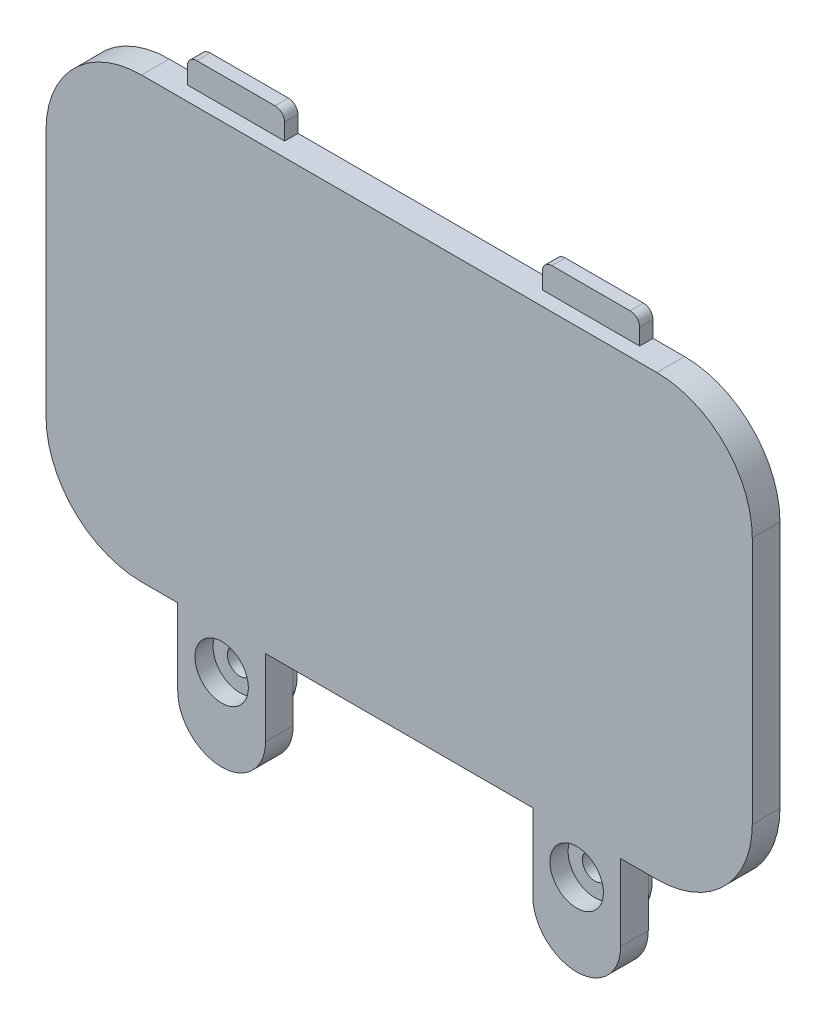
from build123d import *

# Parameters (mm, degrees)
EXTRUSION1_DEPTH                  = 2.9
ESQUISSE2_W                       = 10.2
ESQUISSE2_H                       = 1.4
EXTRUSION2_DEPTH                  = 2.7
CONG_1_R                          = 1
ESQUISSE3_W                       = 20.466591469
ESQUISSE3_H                       = 12.2
ESQUISSE3_W_2                     = 21.733408531
ESQUISSE3_W_3                     = 12.4
ESQUISSE3_H_2                     = 13.863540316
ENL_V_MAT_EXTRU_1_DEPTH           = 1
ESQUISSE4_R                       = 2.8
ENL_V_MAT_EXTRU_2_DEPTH           = 2
EXTRUSION3_DEPTH                  = 1
EXTRUSION3_DEPTH_BACK             = 1
ESQUISSE5_R                       = 4.6
CONG_2_R                          = 1
ESQUISSE6_R                       = 1.3
ENL_V_MAT_EXTRU_4_DEPTH           = 51.085976067
EXTRUSION4_DEPTH                  = 1
R_P_TITION_LIN_AIRE1_COUNT        = 2
R_P_TITION_LIN_AIRE1_PITCH        = 6
R_P_TITION_LIN_AIRE2_COUNT        = 2
R_P_TITION_LIN_AIRE2_PITCH        = 36.6
R_P_TITION_LIN_AIRE2_COPY_1_DEPTH = 1


with BuildPart() as part:
    # Esquisse1 → Extrusion1 (new body)
    with BuildSketch(Plane.XY):
        with BuildLine():
            Line((23.2, -23.001261172), (23.2, -15.001261172))
            Line((23.2, -15.001261172), (27, -15.001261172))
            ThreePointArc((27, -15.001261172), (34.071067812, -12.072328984), (37, -5.001261172))
            Line((37, -5.001261172), (37, 20.998738828))
            ThreePointArc((37, 20.998738828), (34.071067812, 28.069806639), (27, 30.998738828))
            Line((27, 30.998738828), (-27, 30.998738828))
            ThreePointArc((-27, 30.998738828), (-34.071067812, 28.069806639), (-37, 20.998738828))
            Line((-37, 20.998738828), (-37, -5.001261172))
            ThreePointArc((-37, -5.001261172), (-34.071067812, -12.072328984), (-27, -15.001261172))
            Line((-27, -15.001261172), (-23.2, -15.001261172))
            Line((-23.2, -15.001261172), (-23.2, -23.001261172))
            ThreePointArc((-23.2, -23.001261172), (-18.6, -27.601261172), (-14, -23.001261172))
            Line((-14, -23.001261172), (-14, -15.001261172))
            Line((-14, -15.001261172), (14, -15.001261172))
            Line((14, -15.001261172), (14, -23.001261172))
            ThreePointArc((14, -23.001261172), (18.6, -27.601261172), (23.2, -23.001261172))
        make_face()
    extrude(amount=-EXTRUSION1_DEPTH)

    # Esquisse2 → Extrusion2 (add)
    with BuildSketch(Plane(origin=(0, 30.998738828, 0), x_dir=(-1, 0, 0), z_dir=(0, 1, 0))):
        with Locations((-18.6, -2.2)):
            Rectangle(ESQUISSE2_W, ESQUISSE2_H)
        with Locations((18.6, -2.2)):
            Rectangle(ESQUISSE2_W, ESQUISSE2_H)
    extrude(amount=EXTRUSION2_DEPTH)

    # Congé1
    cong_1_edges = [part.edges().sort_by_distance(p)[0] for p in [
        (23.7, 33.698738828, -2.2),
        (13.5, 33.698738828, -2.2),
        (-23.7, 33.698738828, -2.2),
        (-13.5, 33.698738828, -2.2),
    ]]
    fillet(cong_1_edges, radius=CONG_1_R)

    # Esquisse3 → Enlèv. mat.-Extru.1 (cut)
    with BuildSketch(Plane(origin=(0, 0, -2.9), x_dir=(-1, 0, 0), z_dir=(0, 0, -1))):
        with BuildLine():
            Line((35.6, -5.001261172), (35.6, 0.735198512))
            Line((35.6, 0.735198512), (23.2, 0.735198512))
            Line((23.2, 0.735198512), (23.2, -13.601261172))
            Line((23.2, -13.601261172), (27, -13.601261172))
            ThreePointArc((27, -13.601261172), (33.081118318, -11.082379491), (35.6, -5.001261172))
        make_face()
        with BuildLine():
            Line((21.8, -23.001261172), (21.8, -13.601261172))
            Line((21.8, -13.601261172), (21.8, 0.735198512))
            Line((21.8, 0.735198512), (0.066591469, 0.735198512))
            Line((0.066591469, 0.735198512), (0.066591469, -11.464801488))
            Line((0.066591469, -11.464801488), (15.4, -11.464801488))
            Line((15.4, -11.464801488), (15.4, -23.001261172))
            ThreePointArc((15.4, -23.001261172), (18.6, -26.201261172), (21.8, -23.001261172))
        make_face()
        with BuildLine():
            Line((-15.4, -11.464801488), (-1.333408531, -11.464801488))
            Line((-1.333408531, -11.464801488), (-1.333408531, 0.735198512))
            Line((-1.333408531, 0.735198512), (-21.8, 0.735198512))
            Line((-21.8, 0.735198512), (-21.8, -13.601261172))
            Line((-21.8, -13.601261172), (-21.8, -23.001261172))
            ThreePointArc((-21.8, -23.001261172), (-18.6, -26.201261172), (-15.4, -23.001261172))
            Line((-15.4, -23.001261172), (-15.4, -11.464801488))
        make_face()
        with BuildLine():
            Line((-27, -13.601261172), (-23.2, -13.601261172))
            Line((-23.2, -13.601261172), (-23.2, 0.735198512))
            Line((-23.2, 0.735198512), (-35.6, 0.735198512))
            Line((-35.6, 0.735198512), (-35.6, -5.001261172))
            ThreePointArc((-35.6, -5.001261172), (-33.081118318, -11.082379491), (-27, -13.601261172))
        make_face()
        with BuildLine():
            Line((-35.6, 20.998738828), (-35.6, 17.398738828))
            Line((-35.6, 17.398738828), (-23.2, 17.398738828))
            Line((-23.2, 17.398738828), (-23.2, 29.598738828))
            Line((-23.2, 29.598738828), (-27, 29.598738828))
            ThreePointArc((-27, 29.598738828), (-33.081118318, 27.079857146), (-35.6, 20.998738828))
        make_face()
        with BuildLine():
            Line((27, 29.598738828), (23.2, 29.598738828))
            Line((23.2, 29.598738828), (23.2, 17.398738828))
            Line((23.2, 17.398738828), (35.6, 17.398738828))
            Line((35.6, 17.398738828), (35.6, 20.998738828))
            ThreePointArc((35.6, 20.998738828), (33.081118318, 27.079857146), (27, 29.598738828))
        make_face()
        with Locations((-11.566704266, 23.498738828)):
            Rectangle(ESQUISSE3_W, ESQUISSE3_H)
        with Locations((10.933295734, 23.498738828)):
            Rectangle(ESQUISSE3_W_2, ESQUISSE3_H)
        with Locations((-29.4, 9.06696867)):
            Rectangle(ESQUISSE3_W_3, ESQUISSE3_H_2)
        with Locations((-11.566704266, 9.06696867)):
            Rectangle(ESQUISSE3_W, ESQUISSE3_H_2)
        with Locations((10.933295734, 9.06696867)):
            Rectangle(ESQUISSE3_W_2, ESQUISSE3_H_2)
        with Locations((29.4, 9.06696867)):
            Rectangle(ESQUISSE3_W_3, ESQUISSE3_H_2)
    extrude(amount=-ENL_V_MAT_EXTRU_1_DEPTH, mode=Mode.SUBTRACT)

    # Esquisse4 → Enlèv. mat.-Extru.2 (cut)
    with BuildSketch(Plane.XY):
        with Locations((-18.6, -19.001261172)):
            Circle(ESQUISSE4_R)
        with Locations((18.6, -19.001261172)):
            Circle(ESQUISSE4_R)
    extrude(amount=-ENL_V_MAT_EXTRU_2_DEPTH, mode=Mode.SUBTRACT)

    # Esquisse5 → Extrusion3 (add, two sides: drawn at the far end of the back side and taken through both)
    with BuildSketch(Plane(origin=(0, 0, -2.9), x_dir=(-1, 0, 0), z_dir=(0, 0, -1)).offset(-EXTRUSION3_DEPTH_BACK)):
        with Locations((-18.6, -19.001261172)):
            Circle(ESQUISSE5_R)
        with Locations((18.6, -19.001261172)):
            Circle(ESQUISSE5_R)
    extrude(amount=EXTRUSION3_DEPTH + EXTRUSION3_DEPTH_BACK)

    # Congé2
    cong_2_edges = [part.edges().sort_by_distance(p)[0] for p in [
        (23.2, -19.001261172, -3.9),
        (-14, -19.001261172, -3.9),
    ]]
    fillet(cong_2_edges, radius=CONG_2_R - 0.0001)  # a hair under: the kernel refuses the full size

    # Esquisse6 → Enlèv. mat.-Extru.4 (cut, through all)
    with BuildSketch(Plane.XY.offset(-1.9)):
        with Locations((18.6, -19.001261172)):
            Circle(ESQUISSE6_R)
        with Locations((-18.6, -19.001261172)):
            Circle(ESQUISSE6_R)
    extrude(amount=-ENL_V_MAT_EXTRU_4_DEPTH, mode=Mode.SUBTRACT)

    # Esquisse7 → Extrusion4 (add)
    with BuildSketch(Plane.ZY.offset(-21.8)):
        Polygon((-2.9, 32.698738828), (-3.9, 32.334768593), (-3.9, 29.534768593), (-1.9, 27.398738828), (-1.9, 29.598738828), (-2.9, 29.598738828), align=None)
    extrusion4 = extrude(amount=EXTRUSION4_DEPTH)

    # Répétition linéaire1: Extrusion4 ×2
    with Locations(*[(-i * R_P_TITION_LIN_AIRE1_PITCH, 0, 0) for i in range(1, R_P_TITION_LIN_AIRE1_COUNT)]):
        add(extrusion4)

    # Répétition linéaire2: Extrusion4 ×2
    with Locations(*[(-i * R_P_TITION_LIN_AIRE2_PITCH, 0, 0) for i in range(1, R_P_TITION_LIN_AIRE2_COUNT)]):
        add(extrusion4)

    # Répétition linéaire2 copy 1 sketch → Répétition linéaire2 copy 1 (add)
    with BuildSketch(Plane.ZY.offset(20.8)):
        Polygon((-2.9, 32.698738828), (-3.9, 32.334768593), (-3.9, 29.534768593), (-1.9, 27.398738828), (-1.9, 29.598738828), (-2.9, 29.598738828), align=None)
    extrude(amount=R_P_TITION_LIN_AIRE2_COPY_1_DEPTH)


solid = part.part
